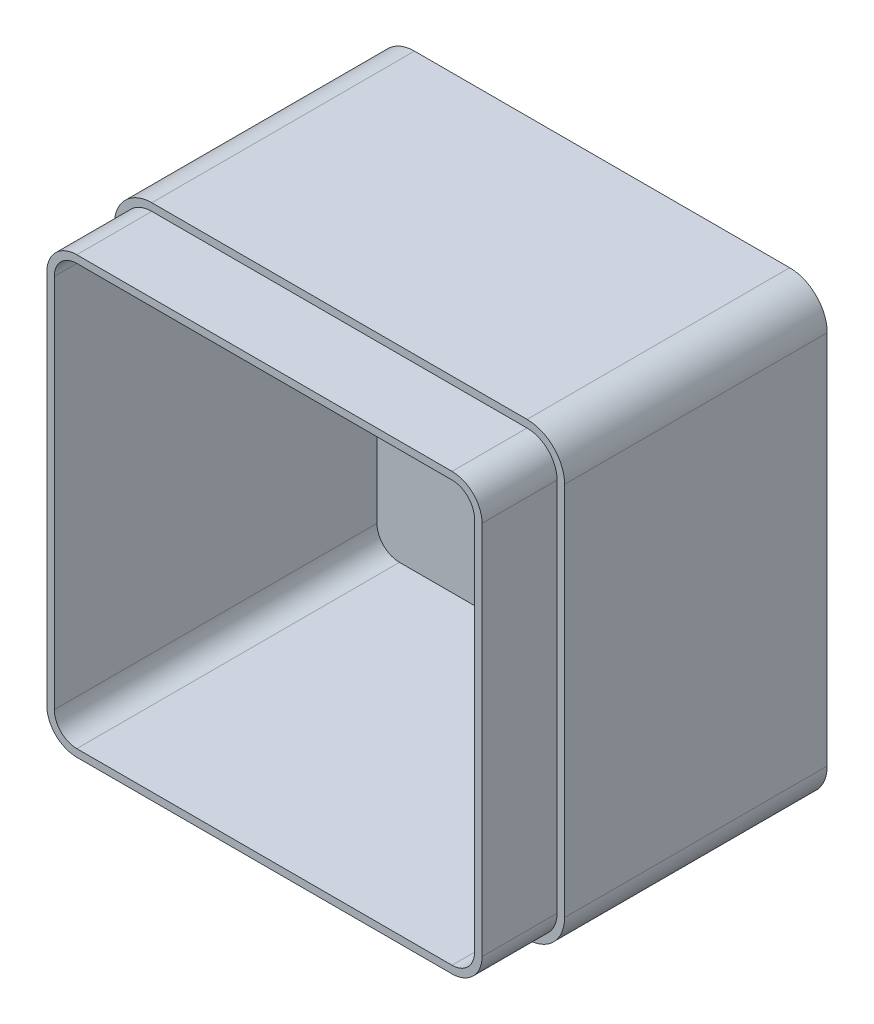
from build123d import *

# Parameters (mm, degrees)
SKETCH1_W           = 120
SKETCH1_H           = 120
BOSS_EXTRUDE1_DEPTH = 90
FILLET1_R           = 10
SHELL1_T            = -4
CUT_EXTRUDE2_DEPTH  = 20


with BuildPart() as part:
    # Sketch1 → Boss-Extrude1 (new body)
    with BuildSketch(Plane.XY):
        with Locations((20.096223412, -34.028145411)):
            Rectangle(SKETCH1_W, SKETCH1_H)
    extrude(amount=BOSS_EXTRUDE1_DEPTH)

    # Fillet1
    fillet1_edges = [part.edges().sort_by_distance(p)[0] for p in [
        (-39.903776588, -94.028145411, 45),
        (80.096223412, -94.028145411, 45),
        (-39.903776588, 25.971854589, 45),
        (80.096223412, 25.971854589, 45),
    ]]
    fillet(fillet1_edges, radius=FILLET1_R)

    # Shell1
    shell1_openings = [part.faces().sort_by_distance(p)[0] for p in [
        (20.096223412, -34.028145411, 90),
    ]]
    offset(amount=SHELL1_T, openings=shell1_openings, kind=Kind.INTERSECTION)

    # Sketch3 → Cut-Extrude2 (cut)
    with BuildSketch(Plane.XY.offset(90)):
        with BuildLine():
            Line((-39.903776588, 15.971854589), (-39.903776588, -84.028145411))
            ThreePointArc((-39.903776588, -84.028145411), (-36.974844399, -91.099213223), (-29.903776588, -94.028145411))
            Line((-29.903776588, -94.028145411), (70.096223412, -94.028145411))
            ThreePointArc((70.096223412, -94.028145411), (77.167291224, -91.099213223), (80.096223412, -84.028145411))
            Line((80.096223412, -84.028145411), (80.096223412, 15.971854589))
            ThreePointArc((80.096223412, 15.971854589), (77.167291224, 23.042922401), (70.096223412, 25.971854589))
            Line((70.096223412, 25.971854589), (-29.903776588, 25.971854589))
            ThreePointArc((-29.903776588, 25.971854589), (-36.974844399, 23.042922401), (-39.903776588, 15.971854589))
        make_face()
        with BuildLine():
            Line((-37.903776588, 15.971854589), (-37.903776588, -84.028145411))
            ThreePointArc((-37.903776588, -84.028145411), (-35.560630837, -89.68499966), (-29.903776588, -92.028145411))
            Line((-29.903776588, -92.028145411), (70.096223412, -92.028145411))
            ThreePointArc((70.096223412, -92.028145411), (75.753077662, -89.68499966), (78.096223412, -84.028145411))
            Line((78.096223412, -84.028145411), (78.096223412, 15.971854589))
            ThreePointArc((78.096223412, 15.971854589), (75.753077662, 21.628708839), (70.096223412, 23.971854589))
            Line((70.096223412, 23.971854589), (-29.903776588, 23.971854589))
            ThreePointArc((-29.903776588, 23.971854589), (-35.560630837, 21.628708839), (-37.903776588, 15.971854589))
        make_face(mode=Mode.SUBTRACT)
    extrude(amount=-CUT_EXTRUDE2_DEPTH, mode=Mode.SUBTRACT)


solid = part.part
